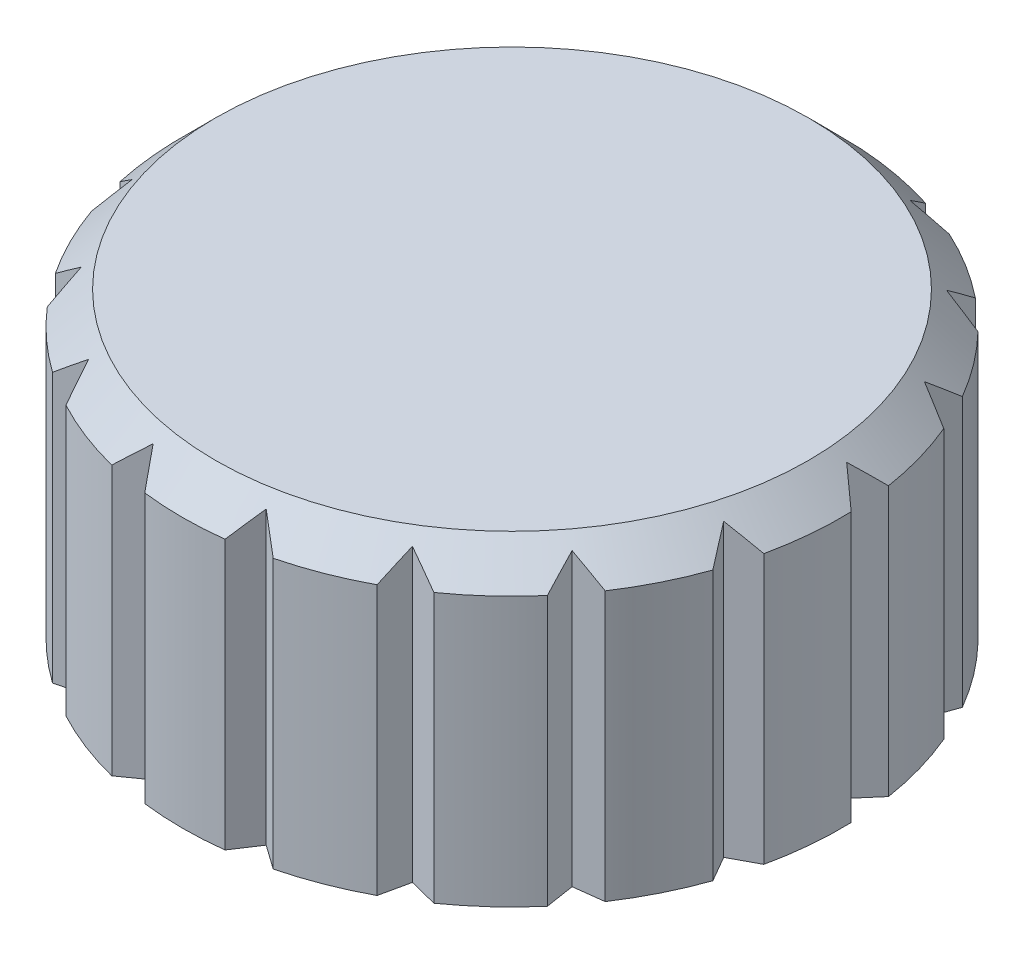
from build123d import *

# Parameters (mm, degrees)
SKETCH1_R           = 12
SKETCH1_R_2         = 10
BOSS_EXTRUDE1_DEPTH = 8
BOSS_EXTRUDE2_START = 8
SKETCH1_2_R         = 12
SKETCH1_2_R_2       = 10
BOSS_EXTRUDE2_DEPTH = 3
CHAMFER1_SIZE       = 1.2
CUT_EXTRUDE1_DEPTH  = 21.223748416
CIRPATTERN1_COUNT   = 17
THREAD1_PITCH       = 2
THREAD1_FROM        = 2
SKETCH2_R           = 7.5
BOSS_EXTRUDE3_DEPTH = 2
CHAMFER2_SIZE       = 2


with BuildPart() as part:
    # Sketch1 → Boss-Extrude1 (new body)
    with BuildSketch(Plane(origin=(0, 0, 0), x_dir=(1, 0, 0), z_dir=(0, 1, 0))):
        with Locations(Location((0, 0, 0), (0, 0, 270))):
            Circle(SKETCH1_R)
        with Locations(Location((0, 0, 0), (0, 0, 270))):
            Circle(SKETCH1_R_2, mode=Mode.SUBTRACT)
    extrude(amount=BOSS_EXTRUDE1_DEPTH)

    # Sketch1<2> → Boss-Extrude2 (add)
    # profile 1 of 4: a face of its own
    with BuildSketch(Plane(origin=(0, 0, 0), x_dir=(1, 0, 0), z_dir=(0, 1, 0)).offset(BOSS_EXTRUDE2_START)):
        with Locations(Location((0, 0, 0), (0, 0, 270))):
            Circle(SKETCH1_2_R)
        with Locations(Location((0, 0, 0), (0, 0, 270))):
            Circle(SKETCH1_2_R_2, mode=Mode.SUBTRACT)
    # profile 2 of 4: a face of its own
    with BuildSketch(Plane(origin=(0, 0, 0), x_dir=(1, 0, 0), z_dir=(0, 1, 0)).offset(BOSS_EXTRUDE2_START)):
        with Locations(Location((0, 0, 0), (0, 0, 270))):
            Circle(SKETCH1_2_R_2)
    # profile 3 of 4: a face of its own
    with BuildSketch(Plane(origin=(0, 0, 0), x_dir=(1, 0, 0), z_dir=(0, 1, 0)).offset(BOSS_EXTRUDE2_START)):
        with BuildLine():
            Line((0, 12), (0, 11.2))
            Line((0, 11.2), (0.751699803, 11.976433))
            ThreePointArc((0.751699803, 11.976433), (0.376034572, 11.994106803), (0, 12))
        make_face()
    # profile 4 of 4: a face of its own
    with BuildSketch(Plane(origin=(0, 0, 0), x_dir=(1, 0, 0), z_dir=(0, 1, 0)).offset(BOSS_EXTRUDE2_START)):
        with BuildLine():
            Line((-0.751699803, 11.976433), (0, 11.2))
            Line((0, 11.2), (0, 12))
            ThreePointArc((0, 12), (-0.376034572, 11.994106803), (-0.751699803, 11.976433))
        make_face()
    extrude(amount=BOSS_EXTRUDE2_DEPTH)

    # Chamfer1
    chamfer1_edges = [part.edges().sort_by_distance(p)[0] for p in [
        (12, 11, 0),
    ]]
    chamfer(chamfer1_edges, length=CHAMFER1_SIZE)

    # Sketch1<4> → Cut-Extrude1 (cut, through all)
    with BuildSketch(Plane(origin=(0, 0, 0), x_dir=(1, 0, 0), z_dir=(0, 1, 0))):
        with BuildLine():
            Line((-0.751699803, 11.976433), (0, 11.2))
            Line((0, 11.2), (0, 12))
            ThreePointArc((0, 12), (-0.376034572, 11.994106803), (-0.751699803, 11.976433))
        make_face()
        with BuildLine():
            Line((0, 12), (0, 11.2))
            Line((0, 11.2), (0.751699803, 11.976433))
            ThreePointArc((0.751699803, 11.976433), (0.376034572, 11.994106803), (0, 12))
        make_face()
    cut_extrude1 = extrude(amount=CUT_EXTRUDE1_DEPTH, mode=Mode.SUBTRACT)

    # CirPattern1: Cut-Extrude1 ×17 about axis
    cirpattern1_axis = Axis((0, 0, 0), (0, 1, 0))
    for i in range(1, CIRPATTERN1_COUNT):
        add(cut_extrude1.rotate(cirpattern1_axis, i * 360 / CIRPATTERN1_COUNT), mode=Mode.SUBTRACT)

    # Thread1: arcs per turn and ends read off the stored shape
    # Thread1: the profile of Thread Profile1 profile screwed along a right-hand helix through 5 turns, 10 arcs to a turn; built about Z, then put on its axis
    thread1_z = Axis((0, 0, 0), (0, 0, 1))
    thread1_corners = [(10.0003, 0, -0.000173205), (10.0003, 0, 1.7501732), (8.91746825, 0, 1.124999997), (8.91746825, 0, 0.624999997)]
    with BuildLine(mode=Mode.PRIVATE) as thread1_profile:
        Line(thread1_corners[0], thread1_corners[1])
        Line(thread1_corners[1], thread1_corners[2])
        Line(thread1_corners[2], thread1_corners[3])
        Line(thread1_corners[3], thread1_corners[0])
    thread1_cap = Face(thread1_profile.wire())
    thread1_turn_angles = [0, 18, 36, 54, 72, 90, 108, 126, 144, 162, 180, 198, 216, 234, 252, 270, 288, 306, 324, 342, 360]
    thread1_turn_weights = [1, 0.9510565162951535, 1, 0.9510565162951535, 1, 0.9510565162951535, 1, 0.9510565162951535, 1, 0.9510565162951535, 1, 0.9510565162951535, 1, 0.9510565162951535, 1, 0.9510565162951535, 1, 0.9510565162951535, 1, 0.9510565162951535, 1]
    thread1_turn_rails = [Edge.make_bspline([Vector(p[0], p[1], 0).rotate(thread1_z, thread1_turn_angles[k]) / thread1_turn_weights[k] + Vector(0, 0, p[2] + THREAD1_PITCH * thread1_turn_angles[k] / 360) for k in range(21)], [0, 0, 0, 1, 1, 2, 2, 3, 3, 4, 4, 5, 5, 6, 6, 7, 7, 8, 8, 9, 9, 10, 10, 10], 2, thread1_turn_weights) for p in thread1_corners]
    thread1_turn_sides = [Face.make_surface_from_curves(thread1_turn_rails[p[0]], thread1_turn_rails[p[1]]) for p in [(0, 1), (1, 2), (2, 3), (3, 0)]]
    thread1 = Plane(origin=(0, -2, 0), x_dir=(1, 0, 0), z_dir=(0, 1, 0)) * split(Solid(Shell([*[p.moved(Location((0, 0, THREAD1_PITCH * i))) for i in range(5) for p in thread1_turn_sides], thread1_cap, thread1_cap.rotate(thread1_z, 1800).moved(Location((0, 0, THREAD1_PITCH * 1800 / 360)))])), bisect_by=Plane.XY.offset(THREAD1_FROM), keep=Keep.TOP, mode=Mode.PRIVATE)
    add(thread1)

    # Sketch2 → Boss-Extrude3 (add)
    with BuildSketch(Plane.XZ.offset(-8)):
        with Locations(Location((0, 0, 0), (0, 0, 90))):
            Circle(SKETCH2_R)
    extrude(amount=BOSS_EXTRUDE3_DEPTH)

    # Chamfer2
    chamfer2_edges = [part.edges().sort_by_distance(p)[0] for p in [
        (0, 6, -7.5),
    ]]
    chamfer(chamfer2_edges, length=CHAMFER2_SIZE - 0.0001)  # a hair under: the kernel refuses the full size


solid = part.part
